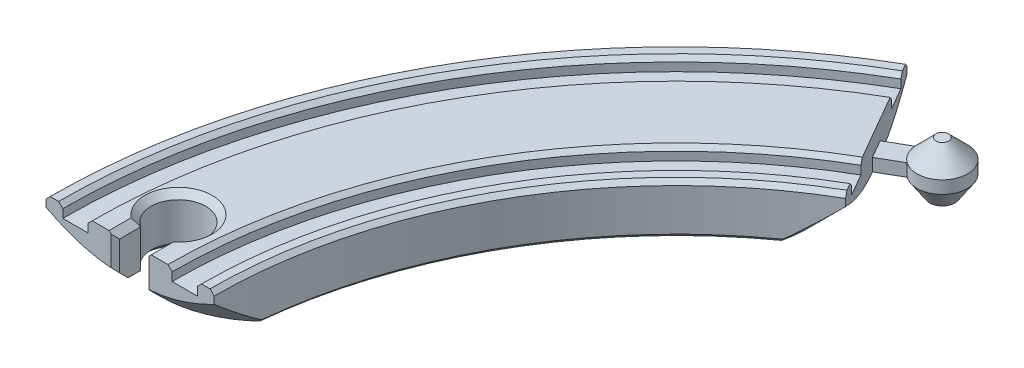
from build123d import *
from build123d.topology import SkipClean

# Parameters (mm, degrees)
REVOLVE1_ANGLE       = 60
CUT_EXTRUDE1_DEPTH   = 151.38335158
BOSS_EXTRUDE1_DEPTH  = 12
BOSS_EXTRUDE2_DEPTH  = 7.5
CUT_EXTRUDE2_DEPTH   = 4.5
CHAMFER2_SIZE        = 4.5
CHAMFER5_SIZE2       = 3
CHAMFER5_SIZE        = 4.5
CHAMFER3_SIZE        = 1.5
CUT_REVOLVE1_ANGLE   = 90
CHAMFER4_SIZE        = 4.5
MIRROR4_COPY_1_ANGLE = 90
CHAMFER1_SIZE        = 1


with BuildPart() as part:
    # Sketch2 → Revolve1 (revolve)
    with BuildSketch(Plane.XY):
        Polygon((-16, 12), (-20, 12), (-20, 0), (20, 0), (20, 12), (16, 12), (16, 9), (10, 9), (10, 12), (-10, 12), (-10, 9), (-16, 9), align=None)
    revolve(axis=Axis((129.9038106, 0, 0), (0, -1, 0)), revolution_arc=REVOLVE1_ANGLE)

    # Sketch3 → Cut-Extrude1 (cut, through all)
    with BuildSketch(Plane(origin=(0, 12, 0), x_dir=(1, 0, 0), z_dir=(0, 1, 0))):
        with BuildLine():
            ThreePointArc((6.5, 11.5), (-3.122498999, 17.200877125), (-3.5, 6.022774425))
            Line((-3.5, 6.022774425), (-3.5, 11.5))
            Line((-3.5, 11.5), (3.5, 11.5))
            Line((3.5, 11.5), (3.5, 6.022774425))
            ThreePointArc((3.5, 6.022774425), (5.700877125, 8.377501001), (6.5, 11.5))
        make_face()
        with BuildLine():
            Line((-3.5, 11.5), (-3.5, 6.022774425))
            ThreePointArc((-3.5, 6.022774425), (0, 5), (3.5, 6.022774425))
            Line((3.5, 6.022774425), (3.5, 11.5))
            Line((3.5, 11.5), (-3.5, 11.5))
        make_face()
        with BuildLine():
            Line((-3.5, 6.022774425), (-3.5, 0))
            Line((-3.5, 0), (3.5, 0))
            Line((3.5, 0), (3.5, 6.022774425))
            ThreePointArc((3.5, 6.022774425), (0, 5), (-3.5, 6.022774425))
        make_face()
    extrude(amount=-CUT_EXTRUDE1_DEPTH, mode=Mode.SUBTRACT)



with BuildPart() as body_2:
    # Sketch4 → Boss-Extrude1 (new body)
    with BuildSketch(Plane(origin=(0, 12, 0), x_dir=(1, 0, 0), z_dir=(0, 1, 0))):
        with BuildLine():
            ThreePointArc((68.937586537, 117.687885509), (69.715045021, 115.250000028), (71.437586537, 113.35775849))
            Line((71.437586537, 113.35775849), (76.161197444, 116.084936519))
            Line((76.161197444, 116.084936519), (73.661197444, 120.415063537))
            Line((73.661197444, 120.415063537), (68.937586537, 117.687885509))
        make_face()
        with BuildLine():
            Line((76.161197444, 116.084936519), (71.437586537, 113.35775849))
            ThreePointArc((71.437586537, 113.35775849), (77.66422619, 112.918880753), (80.911197444, 118.250000028))
            ThreePointArc((80.911197444, 118.250000028), (74.629830638, 124.243399124), (68.937586537, 117.687885509))
            Line((68.937586537, 117.687885509), (73.661197444, 120.415063537))
            Line((73.661197444, 120.415063537), (76.161197444, 116.084936519))
        make_face()
    extrude(amount=-BOSS_EXTRUDE1_DEPTH)


with BuildPart() as part_1:
    add(part.part)

    add(body_2.part)  # Boss-Extrude2 merges body 2
    # Sketch4<3> → Boss-Extrude2 (add)
    with BuildSketch(Plane(origin=(0, 12, 0), x_dir=(1, 0, 0), z_dir=(0, 1, 0))):
        with BuildLine():
            Line((63.7019053, 114.665063537), (66.2019053, 110.334936519))
            Line((66.2019053, 110.334936519), (71.437586537, 113.35775849))
            ThreePointArc((71.437586537, 113.35775849), (69.715045021, 115.250000028), (68.937586537, 117.687885509))
            Line((68.937586537, 117.687885509), (63.7019053, 114.665063537))
        make_face()
    extrude(amount=-BOSS_EXTRUDE2_DEPTH)

    # Sketch4<5> → Cut-Extrude2 (cut)
    with SkipClean():  # the faces are left unmerged after this step: merging them gives an invalid solid
        with BuildSketch(Plane(origin=(0, 12, 0), x_dir=(1, 0, 0), z_dir=(0, 1, 0))):
            with BuildLine():
                Line((63.7019053, 114.665063537), (66.2019053, 110.334936519))
                Line((66.2019053, 110.334936519), (71.437586537, 113.35775849))
                ThreePointArc((71.437586537, 113.35775849), (69.715045021, 115.250000028), (68.937586537, 117.687885509))
                Line((68.937586537, 117.687885509), (63.7019053, 114.665063537))
            make_face()
        extrude(amount=-CUT_EXTRUDE2_DEPTH, mode=Mode.SUBTRACT)

    # Chamfer2
    chamfer2_edges = [part_1.edges().sort_by_distance(p)[0] for p in [
        (80.107349866, 12, -121.250000028),
    ]]
    chamfer(chamfer2_edges, length=CHAMFER2_SIZE - 0.0001)  # a hair under: the kernel refuses the full size

    # Chamfer5
    chamfer5_edges = [part_1.edges().sort_by_distance(p)[0] for p in [
        (80.88480835, 0, -118.812114547),
    ]]
    chamfer5_side = [part_1.faces().sort_by_distance(p)[0] for p in [
        (80.88480835, 0.06, -118.812114547),
    ]]
    chamfer(chamfer5_edges, length=CHAMFER5_SIZE - 0.0001, length2=CHAMFER5_SIZE2 - 0.0001, reference=chamfer5_side[0])  # a hair under: the kernel refuses the full size

    # Chamfer3
    chamfer3_edges = [part_1.edges().sort_by_distance(p)[0] for p in [
        (0, 0, -18),
        (3.5, 0, -3.011387212),
        (-3.5, 12, -3.011387212),
        (-3.5, 0, -3.011387212),
        (0, 12, -18),
        (3.5, 12, -3.011387212),
    ]]
    chamfer(chamfer3_edges, length=CHAMFER3_SIZE)

    # Sketch17 → Cut-Revolve1 (revolve, cut)
    with BuildSketch(Plane(origin=(-33.72595265, 0, -58.415063523), x_dir=(-0.8660254037844378, 0, 0.5000000000000017), z_dir=(-0.5000000000000016, -1.1564823173178769e-15, -0.8660254037844377))):
        Polygon((-118.545643971, 10.545643943), (-118.545643971, 0), (-108.000000028, 0), align=None)
    cut_revolve1 = revolve(axis=Axis((38.154155888, -1.265151723, -99.915063537), (0, 1, 0)), revolution_arc=CUT_REVOLVE1_ANGLE, mode=Mode.SUBTRACT)

    # Mirror1: Cut-Revolve1 across plane
    add(cut_revolve1.mirror(Plane(origin=(-32.47595265, 0, -56.250000014), x_dir=(-0.866025403784439, -2.003086131649547e-15, 0.49999999999999933), z_dir=(-0.4999999999999994, -1.1564823173178701e-15, -0.866025403784439))), mode=Mode.SUBTRACT)

    # Chamfer4
    chamfer4_edges = [part_1.edges().sort_by_distance(p)[0] for p in [
        (64.9519053, 0, -112.500000028),
    ]]
    chamfer(chamfer4_edges, length=CHAMFER4_SIZE - 0.0001)  # a hair under: the kernel refuses the full size

    # Mirror4: Cut-Revolve1 across plane
    add(cut_revolve1.mirror(Plane(origin=(32.47595265, 0, -56.250000014), x_dir=(0.8660254037844382, 0, 0.5000000000000009), z_dir=(0.5000000000000009, 0, -0.8660254037844382))), mode=Mode.SUBTRACT)

    # Mirror4 copy 1 sketch → Mirror4 copy 1 (revolve, cut)
    with BuildSketch(Plane(origin=(2.5, 0, -112.500000028), x_dir=(0, 0, -1), z_dir=(1, 0, 0))):
        Polygon((-118.545643971, 10.545643943), (-118.545643971, 0), (-108.000000028, 0), align=None)
    revolve(axis=Axis((2.5, -1.265151723, -29.5), (0, 1, 0)), revolution_arc=MIRROR4_COPY_1_ANGLE, mode=Mode.SUBTRACT)

    # Chamfer1
    chamfer1_edges = [part_1.edges().sort_by_distance(p)[0] for p in [
        (0.083302496, 0, -74.9519053),
        (34.724318648, 0, -54.9519053),
        (-3.5, 7.508472143, 0),
        (3.5, 7.508472143, 0),
        (3.547404111, 12, -72.9519053),
        (8.743556534, 12, -69.9519053),
        (26.06406461, 12, -59.9519053),
        (31.260217033, 12, -56.9519053),
        (34.724318648, 12, -54.9519053),
        (0.083302496, 12, -74.9519053),
    ]]
    chamfer(chamfer1_edges, length=CHAMFER1_SIZE)


solid = part_1.part
